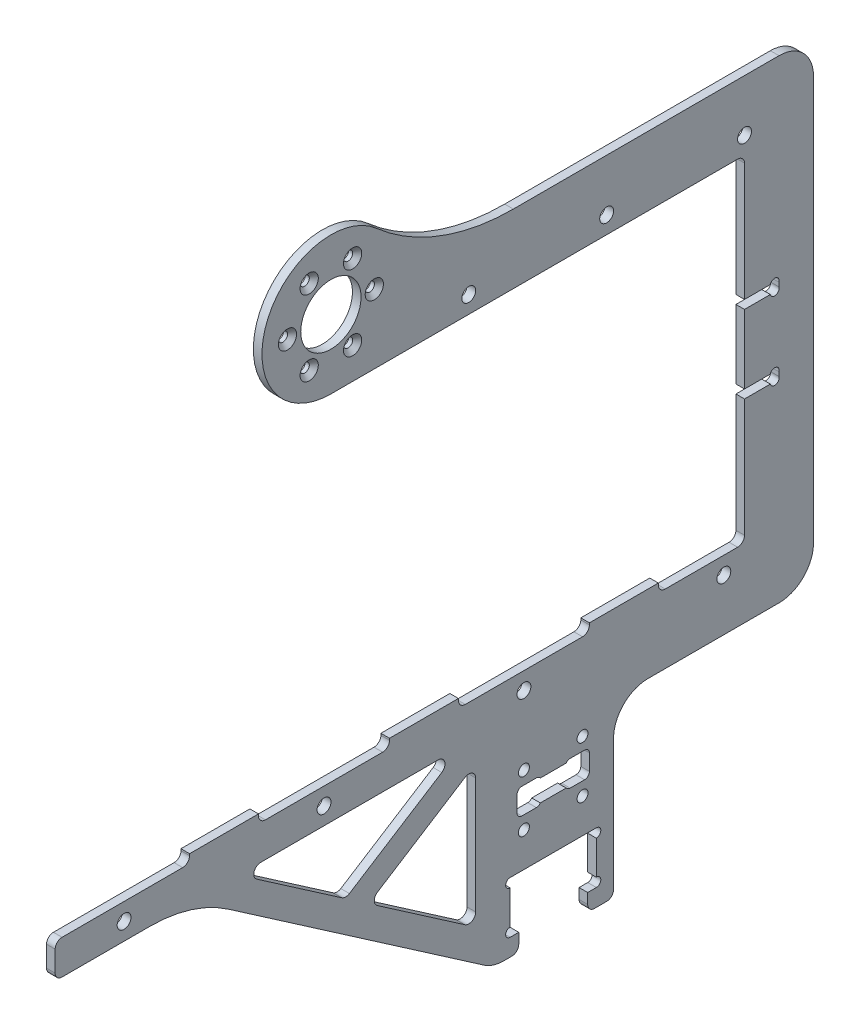
from build123d import *

# Parameters (mm, degrees)
BASE_FLANGE1_DEPTH           = 3.175
SKETCH8_W                    = 12.7
SKETCH8_H                    = 3.175
CUT_EXTRUDE2_DEPTH           = 318.51984313
SKETCH11_R                   = 3.175
CUT_EXTRUDE4_DEPTH           = 318.51984313
SKETCH21_R                   = 2.5527
CUT_EXTRUDE5_DEPTH           = 318.51984313
SKETCH23_W                   = 25.4
SKETCH23_H                   = 3.175
TAB1_DEPTH                   = 3.175
CSK_FOR_M3_SFHCS1_AT_2_COUNT = 2
CSK_FOR_M3_SFHCS1_AT_2_PITCH = 16
CSK_FOR_M3_SFHCS1_AT_3_COUNT = 2
CSK_FOR_M3_SFHCS1_AT_3_PITCH = 27.712812921
CSK_FOR_M3_SFHCS1_AT_4_COUNT = 2
CSK_FOR_M3_SFHCS1_AT_4_PITCH = 32
CSK_FOR_M3_SFHCS1_AT_5_COUNT = 2
CSK_FOR_M3_SFHCS1_AT_5_PITCH = 27.712812921
CSK_FOR_M3_SFHCS1_AT_6_COUNT = 2
CSK_FOR_M3_SFHCS1_AT_6_PITCH = 16
SKETCH27_R                   = 2.0193
CUT_EXTRUDE6_DEPTH           = 318.51984313
CUT_EXTRUDE8_DEPTH           = 318.51984313
FILLET2_R                    = 12.7
SKETCH29_R                   = 11.1125
CUT_EXTRUDE9_DEPTH           = 318.51984313
BREAK_CORNER1_START          = -3.175
BREAK_CORNER1_DEPTH          = 3.175
FILLET1_R                    = 2.54
FILLET4_R                    = 50.8
CUT_EXTRUDE10_DEPTH          = 318.51984313
FILLET5_R                    = 2.54


# Read off the part's stored shape, not the designer's step: Break-Corner1
# Sheet-metal steps are written as plain solids
with BuildPart() as part:
    # Sketch1 → Base-Flange1 (new body)
    with BuildSketch(Plane(origin=(0, 0, 0), x_dir=(0, 0, -1), z_dir=(1, 0, 0))):
        with BuildLine():
            Line((0, -87.3125), (0, 87.3125))
            Line((0, 87.3125), (-110.597916699, 87.3125))
            ThreePointArc((-110.597916699, 87.3125), (-137.538685062, 92.233926782), (-160.999479175, 106.3625))
            ThreePointArc((-160.999479175, 106.3625), (-201.559524406, 96.292756121), (-177.8, 61.9125))
            Line((-177.8, 61.9125), (-25.4, 61.9125))
            Line((-25.4, 61.9125), (-25.4, -61.9125))
            Line((-25.4, -61.9125), (-279.4, -61.9125))
            Line((-279.4, -61.9125), (-279.4, -74.6125))
            Line((-279.4, -74.6125), (-228.6, -74.6125))
            Line((-228.6, -74.6125), (-118.11, -150.8125))
            Line((-118.11, -150.8125), (-108.585, -150.8125))
            Line((-108.585, -150.8125), (-108.585, -144.4625))
            Line((-108.585, -144.4625), (-111.76, -144.4625))
            Line((-111.76, -144.4625), (-111.76, -125.4125))
            Line((-111.76, -125.4125), (-80.01, -125.4125))
            Line((-80.01, -125.4125), (-80.01, -144.4625))
            Line((-80.01, -144.4625), (-83.185, -144.4625))
            Line((-83.185, -144.4625), (-83.185, -150.8125))
            Line((-83.185, -150.8125), (-73.66, -150.8125))
            Line((-73.66, -150.8125), (-73.66, -100.0125))
            ThreePointArc((-73.66, -100.0125), (-69.940256121, -91.032243879), (-60.96, -87.3125))
            Line((-60.96, -87.3125), (0, -87.3125))
        make_face()
    extrude(amount=-BASE_FLANGE1_DEPTH)

    # Sketch8 → Cut-Extrude2 (cut, through all)
    with BuildSketch(Plane(origin=(0, 0, 0), x_dir=(0, 0, -1), z_dir=(1, 0, 0))):
        with Locations((-19.05, 14.2875)):
            Rectangle(SKETCH8_W, SKETCH8_H)
        with Locations((-19.05, -14.2875)):
            Rectangle(SKETCH8_W, SKETCH8_H)
    extrude(amount=-CUT_EXTRUDE2_DEPTH, mode=Mode.SUBTRACT)

    # Sketch11 → Cut-Extrude4 (cut, through all)
    with BuildSketch(Plane(origin=(0, 0, 0), x_dir=(0, 0, -1), z_dir=(1, 0, 0))):
        with Locations((-177.8, 87.3125)):
            Circle(SKETCH11_R)
    extrude(amount=-CUT_EXTRUDE4_DEPTH, mode=Mode.SUBTRACT)

    # Sketch21 → Cut-Extrude5 (cut, through all)
    with BuildSketch(Plane(origin=(0, 0, 0), x_dir=(0, 0, -1), z_dir=(1, 0, 0))):
        with Locations((-33.02, -68.2625)):
            Circle(SKETCH21_R)
        with Locations((-106.68, -68.2625)):
            Circle(SKETCH21_R)
        with Locations((-180.34, -68.2625)):
            Circle(SKETCH21_R)
        with Locations((-254, -68.2625)):
            Circle(SKETCH21_R)
        with Locations((-25.4, 68.2625)):
            Circle(SKETCH21_R)
        with Locations((-76.2, 68.2625)):
            Circle(SKETCH21_R)
        with Locations((-127, 68.2625)):
            Circle(SKETCH21_R)
    extrude(amount=-CUT_EXTRUDE5_DEPTH, mode=Mode.SUBTRACT)

    # Sketch23 → Tab1 (add)
    with BuildSketch(Plane(origin=(0, 0, 0), x_dir=(0, 0, -1), z_dir=(1, 0, 0))):
        with Locations((-217.17, -60.325)):
            Rectangle(SKETCH23_W, SKETCH23_H)
        with Locations((-143.51, -60.325)):
            Rectangle(SKETCH23_W, SKETCH23_H)
        with Locations((-69.85, -60.325)):
            Rectangle(SKETCH23_W, SKETCH23_H)
    extrude(amount=-TAB1_DEPTH)

    # Sketch25 → CSK for M3 SFHCS1 (revolve, cut)
    with BuildSketch(Plane(origin=(0, 87.3125, 161.8), x_dir=(0, 0, -1), z_dir=(0, 1, 0))):
        Polygon((0, 0), (0, 3.175), (1.7, 3.175), (1.7, 1.66), (3.36, 0), align=None)
    csk_for_m3_sfhcs1 = revolve(axis=Axis((6.35, 87.3125, 161.8), (-1, 0, 0)), mode=Mode.SUBTRACT)

    # CSK for M3 SFHCS1 at 2: CSK for M3 SFHCS1 ×2
    with Locations(*[Vector(0, -0.8660254037844383, 0.5000000000000007) * (i * CSK_FOR_M3_SFHCS1_AT_2_PITCH) for i in range(1, CSK_FOR_M3_SFHCS1_AT_2_COUNT)]):
        add(csk_for_m3_sfhcs1, mode=Mode.SUBTRACT)

    # CSK for M3 SFHCS1 at 3: CSK for M3 SFHCS1 ×2
    with Locations(*[Vector(0, -0.5000000000000007, 0.8660254037844384) * (i * CSK_FOR_M3_SFHCS1_AT_3_PITCH) for i in range(1, CSK_FOR_M3_SFHCS1_AT_3_COUNT)]):
        add(csk_for_m3_sfhcs1, mode=Mode.SUBTRACT)

    # CSK for M3 SFHCS1 at 4: CSK for M3 SFHCS1 ×2
    with Locations(*[(0, 0, i * CSK_FOR_M3_SFHCS1_AT_4_PITCH) for i in range(1, CSK_FOR_M3_SFHCS1_AT_4_COUNT)]):
        add(csk_for_m3_sfhcs1, mode=Mode.SUBTRACT)

    # CSK for M3 SFHCS1 at 5: CSK for M3 SFHCS1 ×2
    with Locations(*[Vector(0, 0.500000000000001, 0.866025403784438) * (i * CSK_FOR_M3_SFHCS1_AT_5_PITCH) for i in range(1, CSK_FOR_M3_SFHCS1_AT_5_COUNT)]):
        add(csk_for_m3_sfhcs1, mode=Mode.SUBTRACT)

    # CSK for M3 SFHCS1 at 6: CSK for M3 SFHCS1 ×2
    with Locations(*[Vector(0, 0.8660254037844392, 0.49999999999999917) * (i * CSK_FOR_M3_SFHCS1_AT_6_PITCH) for i in range(1, CSK_FOR_M3_SFHCS1_AT_6_COUNT)]):
        add(csk_for_m3_sfhcs1, mode=Mode.SUBTRACT)

    # Sketch27 → Cut-Extrude6 (cut, through all)
    with BuildSketch(Plane(origin=(0, 0, 0), x_dir=(0, 0, -1), z_dir=(1, 0, 0))):
        with Locations((-85.09, -93.6625)):
            Circle(SKETCH27_R)
        with Locations(Location((-85.09, -112.7125, 0), (0, 0, 180))):
            Circle(SKETCH27_R)
        with Locations((-106.68, -112.7125)):
            Circle(SKETCH27_R)
        with Locations(Location((-106.68, -93.6625, 0), (0, 0, 180))):
            Circle(SKETCH27_R)
        with BuildLine():
            Line((-107.442, -98.45675), (-102.106618912, -98.45675))
            ThreePointArc((-102.106618912, -98.45675), (-101.283564844, -98.658721447), (-100.6475, -99.21875))
            Line((-100.6475, -99.21875), (-91.1225, -99.21875))
            ThreePointArc((-91.1225, -99.21875), (-90.486435156, -98.658721447), (-89.663381088, -98.45675))
            Line((-89.663381088, -98.45675), (-84.328, -98.45675))
            ThreePointArc((-84.328, -98.45675), (-83.070764143, -98.977514143), (-82.55, -100.23475))
            Line((-82.55, -100.23475), (-82.55, -106.14025))
            ThreePointArc((-82.55, -106.14025), (-83.070764143, -107.397485857), (-84.328, -107.91825))
            Line((-84.328, -107.91825), (-89.663381088, -107.91825))
            ThreePointArc((-89.663381088, -107.91825), (-90.486435156, -107.716278553), (-91.1225, -107.15625))
            Line((-91.1225, -107.15625), (-100.6475, -107.15625))
            ThreePointArc((-100.6475, -107.15625), (-101.283564844, -107.716278553), (-102.106618912, -107.91825))
            Line((-102.106618912, -107.91825), (-107.442, -107.91825))
            ThreePointArc((-107.442, -107.91825), (-108.699235857, -107.397485857), (-109.22, -106.14025))
            Line((-109.22, -106.14025), (-109.22, -100.23475))
            ThreePointArc((-109.22, -100.23475), (-108.699235857, -98.977514143), (-107.442, -98.45675))
        make_face()
    extrude(amount=-CUT_EXTRUDE6_DEPTH, mode=Mode.SUBTRACT)

    # Sketch28 → Cut-Extrude8 (cut, through all)
    with BuildSketch(Plane(origin=(0, 0, 0), x_dir=(0, 0, -1), z_dir=(1, 0, 0))):
        with BuildLine():
            Line((-111.76, -144.4625), (-111.76, -141.1605))
            ThreePointArc((-111.76, -141.1605), (-113.411, -142.8115), (-111.76, -144.4625))
        make_face()
        with BuildLine():
            Line((-80.01, -144.4625), (-80.01, -141.1605))
            ThreePointArc((-80.01, -141.1605), (-78.359, -142.8115), (-80.01, -144.4625))
        make_face()
        with BuildLine():
            Line((-80.01, -125.4125), (-80.01, -128.7145))
            ThreePointArc((-80.01, -128.7145), (-78.359, -127.0635), (-80.01, -125.4125))
        make_face()
        with BuildLine():
            Line((-111.76, -125.4125), (-111.76, -128.7145))
            ThreePointArc((-111.76, -128.7145), (-113.411, -127.0635), (-111.76, -125.4125))
        make_face()
        with BuildLine():
            ThreePointArc((-15.458644321, -14.2875), (-14.298573876, -17.11325), (-13.138503431, -14.2875))
            ThreePointArc((-13.138503431, -14.2875), (-14.298573876, -11.46175), (-15.458644321, -14.2875))
        make_face()
        with BuildLine():
            ThreePointArc((-15.458644321, 14.2875), (-14.298573876, 11.46175), (-13.138503431, 14.2875))
            ThreePointArc((-13.138503431, 14.2875), (-14.298573876, 17.11325), (-15.458644321, 14.2875))
        make_face()
    extrude(amount=-CUT_EXTRUDE8_DEPTH, mode=Mode.SUBTRACT)

    # Fillet2
    fillet2_edges = [part.edges().sort_by_distance(p)[0] for p in [
        (-1.5875, -87.3125, 0),
        (-1.5875, -150.8125, 118.11),
    ]]
    fillet(fillet2_edges, radius=FILLET2_R)

    # Sketch29 → Cut-Extrude9 (cut, through all)
    with BuildSketch(Plane.ZY.offset(3.175)):
        with Locations((177.8, 87.3125)):
            Circle(SKETCH29_R)
    extrude(amount=-CUT_EXTRUDE9_DEPTH, mode=Mode.SUBTRACT)

    # Break-Corner1 outline → Break-Corner1 (cut)
    with BuildSketch(Plane.YZ.offset(BREAK_CORNER1_START)):
        with BuildLine():
            ThreePointArc((87.3125, 12.7), (83.592756121, 3.719743879), (74.6125, 0))
            Line((74.6125, 0), (87.3125, 0))
            Line((87.3125, 0), (87.3125, 12.7))
        make_face()
    extrude(amount=BREAK_CORNER1_DEPTH, mode=Mode.SUBTRACT)

    # Fillet1
    fillet1_edges = [part.edges().sort_by_distance(p)[0] for p in [
        (-1.5875, -61.9125, 229.87),
        (-1.5875, -61.9125, 204.47),
        (-1.5875, -61.9125, 156.21),
        (-1.5875, -61.9125, 130.81),
        (-1.5875, -61.9125, 82.55),
        (-1.5875, -61.9125, 57.15),
        (-1.5875, -150.8125, 73.66),
        (-1.5875, -150.8125, 83.185),
        (-1.5875, -150.8125, 108.585),
        (-1.5875, -74.6125, 279.4),
        (-1.5875, -61.9125, 279.4),
        (-1.5875, -61.9125, 25.4),
        (-1.5875, 61.9125, 25.4),
    ]]
    fillet(fillet1_edges, radius=FILLET1_R)

    # Fillet4
    fillet4_edges = [part.edges().sort_by_distance(p)[0] for p in [
        (-1.5875, -74.6125, 228.6),
    ]]
    fillet(fillet4_edges, radius=FILLET4_R)

    # Sketch30 → Cut-Extrude10 (cut, through all)
    with BuildSketch(Plane.ZY.offset(3.175)):
        Polygon((124.46, -134.86266966), (163.882081016, -107.67502758), (124.46, -82.654490572), align=None)
        Polygon((211.822746006, -74.6125), (129.564117224, -74.6125), (172.400664991, -101.80014208), align=None)
    extrude(amount=-CUT_EXTRUDE10_DEPTH, mode=Mode.SUBTRACT)

    # Fillet5
    fillet5_edges = [part.edges().sort_by_distance(p)[0] for p in [
        (-1.5875, -74.6125, 211.822746006),
        (-1.5875, -101.80014208, 172.400664991),
        (-1.5875, -74.6125, 129.564117224),
        (-1.5875, -134.86266966, 124.46),
        (-1.5875, -82.654490572, 124.46),
        (-1.5875, -107.67502758, 163.882081016),
    ]]
    fillet(fillet5_edges, radius=FILLET5_R)


solid = part.part
